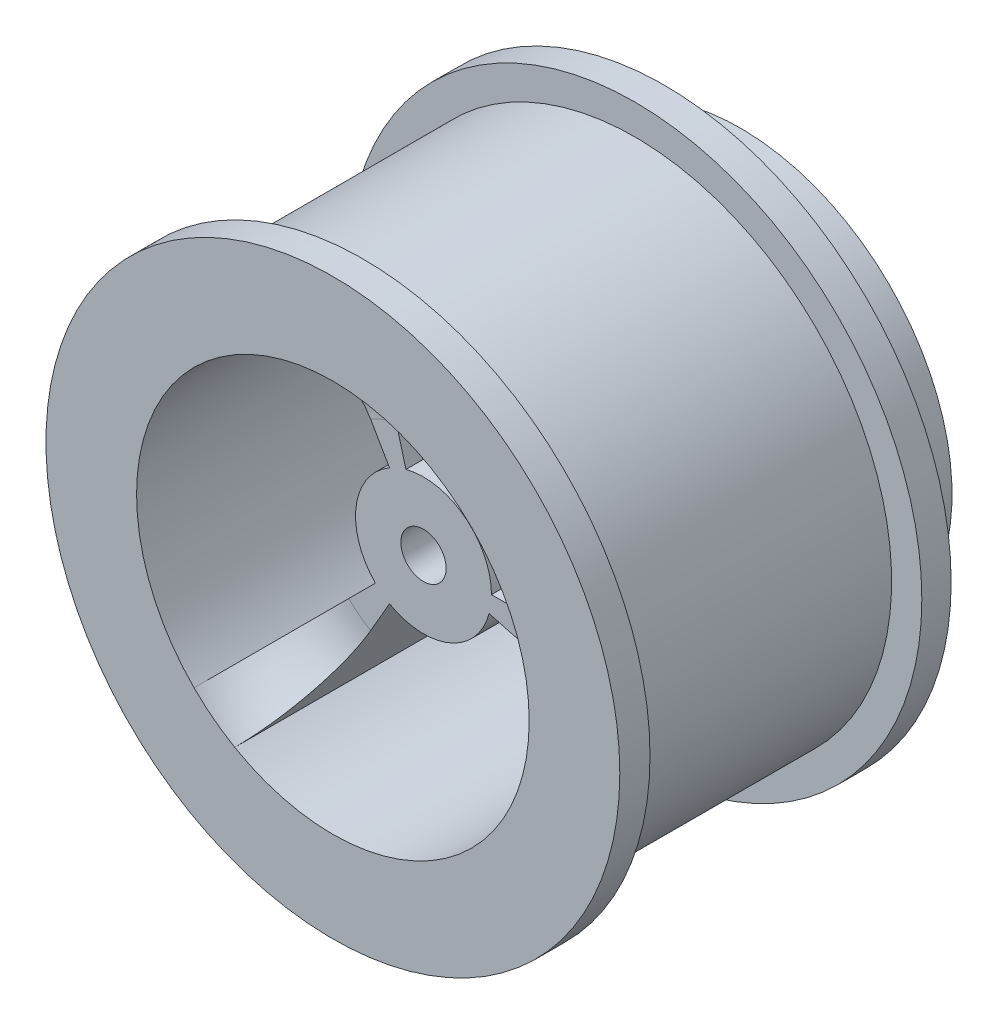
from build123d import *

# Parameters (mm, degrees)
SKETCH1_R             = 8.5
SKETCH1_R_2           = 6.5
BOSS_EXTRUDE1_DEPTH   = 9
SKETCH1_R_3           = 2.25
SKETCH1_R_4           = 0.75
BOSS_EXTRUDE1_2_DEPTH = 9
SKETCH2_R             = 9.5
BOSS_EXTRUDE2_DEPTH   = 1.5
SKETCH3_R             = 9.5
SKETCH3_R_2           = 6.5
BOSS_EXTRUDE3_DEPTH   = 1
BOSS_EXTRUDE4_REACH   = 19.051
CIRPATTERN1_COUNT     = 3
CUT_EXTRUDE2_START    = -2
SKETCH6_R             = 6.5
CUT_EXTRUDE2_DEPTH    = 2
FILLET1_R             = 3
BOSS_EXTRUDE5_START   = 1
SKETCH8_R             = 6.5
BOSS_EXTRUDE5_DEPTH   = 1
SKETCH7_R             = 1
CUT_EXTRUDE3_DEPTH    = 7
CIRPATTERN2_COUNT     = 3
FILLET2_R             = 1
SKETCH10_R            = 7
BOSS_EXTRUDE6_DEPTH   = 1
CUT_EXTRUDE5_START    = -14.5
SKETCH12_R            = 0.75
CUT_EXTRUDE5_DEPTH    = 14.5
SKETCH13_R            = 2.5
CUT_EXTRUDE6_DEPTH    = 2.5


with BuildPart() as part:
    # Sketch1 → Boss-Extrude1 (new body)
    with BuildSketch(Plane.XY):
        Circle(SKETCH1_R)
        Circle(SKETCH1_R_2, mode=Mode.SUBTRACT)
    extrude(amount=BOSS_EXTRUDE1_DEPTH)



with BuildPart() as body_2:
    # Sketch1 → Boss-Extrude1 2 (new body)
    with BuildSketch(Plane.XY):
        Circle(SKETCH1_R_3)
        Circle(SKETCH1_R_4, mode=Mode.SUBTRACT)
    extrude(amount=BOSS_EXTRUDE1_2_DEPTH)


with BuildPart() as part_1:
    add(part.part)

    add(body_2.part)  # Boss-Extrude2 merges body 2
    # Sketch2 → Boss-Extrude2 (add)
    with BuildSketch(Plane(origin=(0, 0, 0), x_dir=(-1, 0, 0), z_dir=(0, 0, -1))):
        Circle(SKETCH2_R)
    extrude(amount=BOSS_EXTRUDE2_DEPTH)

    # Sketch3 → Boss-Extrude3 (add)
    with BuildSketch(Plane.XY.offset(9)):
        Circle(SKETCH3_R)
        Circle(SKETCH3_R_2, mode=Mode.SUBTRACT)
    extrude(amount=BOSS_EXTRUDE3_DEPTH)

    # Sketch5 → Boss-Extrude4 (add, up to next)
    with BuildSketch(Plane.XY.offset(9), mode=Mode.PRIVATE) as boss_extrude4_sk1:
        with BuildLine():
            Line((2.25, 0), (6.5, 0))
            ThreePointArc((6.5, 0), (6.444391599, -0.848420249), (6.278517871, -1.682323793))
            Line((6.278517871, -1.682323793), (2.173333109, -0.582342851))
            ThreePointArc((2.173333109, -0.582342851), (2.230750938, -0.293683932), (2.25, 0))
        make_face()
    boss_extrude4_tool1 = extrude(boss_extrude4_sk1.sketch, amount=-BOSS_EXTRUDE4_REACH, mode=Mode.PRIVATE) - part_1.part
    boss_extrude4 = boss_extrude4_tool1.solids().sort_by_distance((4.665326, -0.614202, 9))[0]
    add(boss_extrude4)

    # CirPattern1: Boss-Extrude4 ×3 about axis
    cirpattern1_axis = Axis((0, 0, 0), (0, 0, 1))
    for i in range(1, CIRPATTERN1_COUNT):
        add(boss_extrude4.rotate(cirpattern1_axis, i * 360 / CIRPATTERN1_COUNT))

    # Sketch6 → Cut-Extrude2 (cut)
    with BuildSketch(Plane.XY.offset(9).offset(CUT_EXTRUDE2_START)):
        Circle(SKETCH6_R)
    extrude(amount=CUT_EXTRUDE2_DEPTH, mode=Mode.SUBTRACT)

    # Fillet1
    # the kernel refuses this fillet: 3 mm, written as the material it adds along each edge
    with BuildSketch(Plane(origin=(0, 0, 7), x_dir=(0.9659258262890711, -0.2588190451025104, 0), z_dir=(-0.2588190451025104, -0.9659258262890711, 0))) as fillet1_piece_1:
        with BuildLine():
            CenterArc((6.5 - FILLET1_R, FILLET1_R), FILLET1_R, 270, 90)
            Line((6.5 - FILLET1_R, 0), (6.5, 0))
            Line((6.5, 0), (6.5, FILLET1_R))
        make_face()
    revolve(axis=Axis((0, 0, 7), (0, 0, 1)), revolution_arc=15)
    with BuildSketch(Plane(origin=(0, 0, 7), x_dir=(-0.2588190451025142, 0.9659258262890701, 0), z_dir=(0.9659258262890701, 0.2588190451025142, 0))) as fillet1_piece_2:
        with BuildLine():
            CenterArc((6.5 - FILLET1_R, FILLET1_R), FILLET1_R, 270, 90)
            Line((6.5 - FILLET1_R, 0), (6.5, 0))
            Line((6.5, 0), (6.5, FILLET1_R))
        make_face()
    revolve(axis=Axis((0, 0, 7), (0, 0, 1)), revolution_arc=15)
    with BuildSketch(Plane(origin=(0, 0, 7), x_dir=(-0.7071067811865505, -0.7071067811865446, 0), z_dir=(-0.7071067811865446, 0.7071067811865505, 0))) as fillet1_piece_3:
        with BuildLine():
            CenterArc((6.5 - FILLET1_R, FILLET1_R), FILLET1_R, 270, 90)
            Line((6.5 - FILLET1_R, 0), (6.5, 0))
            Line((6.5, 0), (6.5, FILLET1_R))
        make_face()
    revolve(axis=Axis((0, 0, 7), (0, 0, 1)), revolution_arc=15)

    # Sketch8 → Boss-Extrude5 (add)
    with BuildSketch(Plane(origin=(0, 0, -1.5), x_dir=(-1, 0, 0), z_dir=(0, 0, -1)).offset(BOSS_EXTRUDE5_START)):
        Circle(SKETCH8_R)
    extrude(amount=-BOSS_EXTRUDE5_DEPTH)

    # Sketch7 → Cut-Extrude3 (cut)
    with BuildSketch(Plane.XY):
        with Locations((1.722075446, -4.157457896)):
            Circle(SKETCH7_R)
    cut_extrude3 = extrude(amount=-CUT_EXTRUDE3_DEPTH, mode=Mode.SUBTRACT)

    # CirPattern2: Cut-Extrude3 ×3 about axis
    cirpattern2_axis = Axis((0, 0, 0), (0, 0, 1))
    for i in range(1, CIRPATTERN2_COUNT):
        add(cut_extrude3.rotate(cirpattern2_axis, i * 360 / CIRPATTERN2_COUNT), mode=Mode.SUBTRACT)

    # Fillet2
    # the kernel refuses this fillet: 1 mm, written as the material it adds along each edge
    with BuildSketch(Plane(origin=(0, 0, 0), x_dir=(0.9268638778365579, -0.37539759184333915, 0), z_dir=(-0.37539759184333915, -0.9268638778365579, 0))) as fillet2_piece_1:
        with BuildLine():
            CenterArc((6.5 - FILLET2_R, FILLET2_R), FILLET2_R, 270, 90)
            Line((6.5 - FILLET2_R, 0), (6.5, 0))
            Line((6.5, 0), (6.5, FILLET2_R))
        make_face()
    revolve(axis=Axis((0, 0, 0), (0, 0, 1)), revolution_arc=149.097777135)
    with BuildSketch(Plane(origin=(-0.25, 0, 0), x_dir=(0, 0, 1), z_dir=(1, 0, 0))) as fillet2_piece_2_section:
        with BuildLine():
            CenterArc((FILLET2_R, -FILLET2_R), FILLET2_R, 90, 90)
            Line((0, -FILLET2_R), (0, 0))
            Line((0, 0), (FILLET2_R, 0))
        make_face()
    fillet2_piece_2 = extrude(amount=9.25, mode=Mode.PRIVATE)
    fillet2_piece_2 = fillet2_piece_2 - Plane(origin=(0, 0, 0.222961637), x_dir=(1, 0, 0), z_dir=(0, 0, -1)) * Cylinder(0.75, 23, mode=Mode.PRIVATE)
    fillet2_piece_2 = fillet2_piece_2 & Plane(origin=(0, 0, 0.222961637), x_dir=(1, 0, 0), z_dir=(0, 0, -1)) * Cylinder(8.5, 23, mode=Mode.PRIVATE)
    add(fillet2_piece_2)
    with BuildSketch(Plane(origin=(8.693332437, -2.329371406, 0), x_dir=(0, 0, 1), z_dir=(-0.9659258262890682, 0.25881904510252135, 0))) as fillet2_piece_3_section:
        with BuildLine():
            CenterArc((FILLET2_R, -FILLET2_R), FILLET2_R, 90, 90)
            Line((0, -FILLET2_R), (0, 0))
            Line((0, 0), (FILLET2_R, 0))
        make_face()
    fillet2_piece_3 = extrude(amount=9.25, mode=Mode.PRIVATE)
    fillet2_piece_3 = fillet2_piece_3 - Plane(origin=(0, 0, 0.222961624), x_dir=(1, 0, 0), z_dir=(0, 0, -1)) * Cylinder(0.75, 23, mode=Mode.PRIVATE)
    fillet2_piece_3 = fillet2_piece_3 & Plane(origin=(0, 0, 0.222961624), x_dir=(1, 0, 0), z_dir=(0, 0, -1)) * Cylinder(8.5, 23, mode=Mode.PRIVATE)
    add(fillet2_piece_3)
    with BuildSketch(Plane(origin=(0, 0, 0), x_dir=(-0.138328087862445, 0.9903864599782852, 0), z_dir=(0.9903864599782852, 0.138328087862445, 0))) as fillet2_piece_4:
        with BuildLine():
            CenterArc((6.5 - FILLET2_R, FILLET2_R), FILLET2_R, 270, 90)
            Line((6.5 - FILLET2_R, 0), (6.5, 0))
            Line((6.5, 0), (6.5, FILLET2_R))
        make_face()
    revolve(axis=Axis((0, 0, 0), (0, 0, 1)), revolution_arc=149.097777135)
    with BuildSketch(Plane(origin=(0, 0, 0), x_dir=(0.5547978045957125, 0.8319852138204006, 0), z_dir=(0.8319852138204006, -0.5547978045957125, 0))) as fillet2_piece_5:
        with BuildLine():
            CenterArc((2.25 + FILLET2_R, FILLET2_R), FILLET2_R, 180, 90)
            Line((2.25 + FILLET2_R, 0), (2.25, 0))
            Line((2.25, 0), (2.25, FILLET2_R))
        make_face()
    revolve(axis=Axis((0, 0, 0), (0, 0, 1)), revolution_arc=232.393578389)
    with BuildSketch(Plane(origin=(0.125, -0.216506351, 0), x_dir=(0, 0, 1), z_dir=(-0.49999999999999983, 0.8660254037844388, 0))) as fillet2_piece_6_section:
        with BuildLine():
            CenterArc((FILLET2_R, -FILLET2_R), FILLET2_R, 90, 90)
            Line((0, -FILLET2_R), (0, 0))
            Line((0, 0), (FILLET2_R, 0))
        make_face()
    fillet2_piece_6 = extrude(amount=9.25, mode=Mode.PRIVATE)
    fillet2_piece_6 = fillet2_piece_6 - Plane(origin=(0, 0, 0.222961635), x_dir=(1, 0, 0), z_dir=(0, 0, -1)) * Cylinder(0.75, 23, mode=Mode.PRIVATE)
    fillet2_piece_6 = fillet2_piece_6 & Plane(origin=(0, 0, 0.222961635), x_dir=(1, 0, 0), z_dir=(0, 0, -1)) * Cylinder(8.5, 23, mode=Mode.PRIVATE)
    add(fillet2_piece_6)
    with BuildSketch(Plane(origin=(-2.329371406, 8.693332437, 0), x_dir=(0, 0, 1), z_dir=(0.25881904510251996, -0.9659258262890685, 0))) as fillet2_piece_7_section:
        with BuildLine():
            CenterArc((FILLET2_R, -FILLET2_R), FILLET2_R, 90, 90)
            Line((0, -FILLET2_R), (0, 0))
            Line((0, 0), (FILLET2_R, 0))
        make_face()
    fillet2_piece_7 = extrude(amount=9.25, mode=Mode.PRIVATE)
    fillet2_piece_7 = fillet2_piece_7 - Plane(origin=(0, 0, 0.222961632), x_dir=(1, 0, 0), z_dir=(0, 0, -1)) * Cylinder(0.75, 23, mode=Mode.PRIVATE)
    fillet2_piece_7 = fillet2_piece_7 & Plane(origin=(0, 0, 0.222961632), x_dir=(1, 0, 0), z_dir=(0, 0, -1)) * Cylinder(8.5, 23, mode=Mode.PRIVATE)
    add(fillet2_piece_7)
    with BuildSketch(Plane(origin=(0, 0, 0), x_dir=(-0.7885357899741134, -0.614988868134945, 0), z_dir=(-0.614988868134945, 0.7885357899741134, 0))) as fillet2_piece_8:
        with BuildLine():
            CenterArc((6.5 - FILLET2_R, FILLET2_R), FILLET2_R, 270, 90)
            Line((6.5 - FILLET2_R, 0), (6.5, 0))
            Line((6.5, 0), (6.5, FILLET2_R))
        make_face()
    revolve(axis=Axis((0, 0, 0), (0, 0, 1)), revolution_arc=149.097777135)
    with BuildSketch(Plane(origin=(0, 0, 0), x_dir=(-0.9979192330393512, 0.06447638583352278, 0), z_dir=(0.06447638583352278, 0.9979192330393512, 0))) as fillet2_piece_9:
        with BuildLine():
            CenterArc((2.25 + FILLET2_R, FILLET2_R), FILLET2_R, 180, 90)
            Line((2.25 + FILLET2_R, 0), (2.25, 0))
            Line((2.25, 0), (2.25, FILLET2_R))
        make_face()
    revolve(axis=Axis((0, 0, 0), (0, 0, 1)), revolution_arc=232.393578389)
    with BuildSketch(Plane(origin=(0.125, 0.216506351, 0), x_dir=(0, 0, 1), z_dir=(-0.5000000000000004, -0.8660254037844384, 0))) as fillet2_piece_10_section:
        with BuildLine():
            CenterArc((FILLET2_R, -FILLET2_R), FILLET2_R, 90, 90)
            Line((0, -FILLET2_R), (0, 0))
            Line((0, 0), (FILLET2_R, 0))
        make_face()
    fillet2_piece_10 = extrude(amount=9.25, mode=Mode.PRIVATE)
    fillet2_piece_10 = fillet2_piece_10 - Plane(origin=(0, 0, 0.222961664), x_dir=(1, 0, 0), z_dir=(0, 0, -1)) * Cylinder(0.75, 23, mode=Mode.PRIVATE)
    fillet2_piece_10 = fillet2_piece_10 & Plane(origin=(0, 0, 0.222961664), x_dir=(1, 0, 0), z_dir=(0, 0, -1)) * Cylinder(8.5, 23, mode=Mode.PRIVATE)
    add(fillet2_piece_10)
    with BuildSketch(Plane(origin=(-6.363961031, -6.363961031, 0), x_dir=(0, 0, 1), z_dir=(0.7071067811865483, 0.7071067811865468, 0))) as fillet2_piece_11_section:
        with BuildLine():
            CenterArc((FILLET2_R, -FILLET2_R), FILLET2_R, 90, 90)
            Line((0, -FILLET2_R), (0, 0))
            Line((0, 0), (FILLET2_R, 0))
        make_face()
    fillet2_piece_11 = extrude(amount=9.25, mode=Mode.PRIVATE)
    fillet2_piece_11 = fillet2_piece_11 - Plane(origin=(0, 0, 0.22296162), x_dir=(1, 0, 0), z_dir=(0, 0, -1)) * Cylinder(0.75, 23, mode=Mode.PRIVATE)
    fillet2_piece_11 = fillet2_piece_11 & Plane(origin=(0, 0, 0.22296162), x_dir=(1, 0, 0), z_dir=(0, 0, -1)) * Cylinder(8.5, 23, mode=Mode.PRIVATE)
    add(fillet2_piece_11)
    with BuildSketch(Plane(origin=(0, 0, 0), x_dir=(0.44312142844363894, -0.8964615996539222, 0), z_dir=(-0.8964615996539222, -0.44312142844363894, 0))) as fillet2_piece_12:
        with BuildLine():
            CenterArc((2.25 + FILLET2_R, FILLET2_R), FILLET2_R, 180, 90)
            Line((2.25 + FILLET2_R, 0), (2.25, 0))
            Line((2.25, 0), (2.25, FILLET2_R))
        make_face()
    revolve(axis=Axis((0, 0, 0), (0, 0, 1)), revolution_arc=232.393578389)

    # Sketch10 → Boss-Extrude6 (add)
    with BuildSketch(Plane(origin=(0, 0, -2.5), x_dir=(-1, 0, 0), z_dir=(0, 0, -1))):
        Circle(SKETCH10_R)
    extrude(amount=BOSS_EXTRUDE6_DEPTH)

    # Sketch11 → Cut-Revolve1 (revolve, cut)
    with BuildSketch(Plane(origin=(0, 0, 0), x_dir=(1, 0, 0), z_dir=(0, 1, 0)), mode=Mode.PRIVATE) as cut_revolve1_sk:
        Polygon((-6.5, 2.5), (-10.5, 3.205307923), (-10.5, 0.794692077), (-6.5, 1.5), align=None)
    revolve(cut_revolve1_sk.sketch.rotate(Axis((0, 0, 0), (0, 0, -1)), 180), axis=Axis((0, 0, 0), (0, 0, -1)), mode=Mode.SUBTRACT)

    # Sketch12 → Cut-Extrude5 (cut)
    with BuildSketch(Plane.XY.offset(7).offset(CUT_EXTRUDE5_START)):
        with Locations(Location((0, 0, 0), (0, 0, 180))):
            Circle(SKETCH12_R)
    extrude(amount=CUT_EXTRUDE5_DEPTH, mode=Mode.SUBTRACT)

    # Sketch13 → Cut-Extrude6 (cut)
    with BuildSketch(Plane(origin=(0, 0, -3.5), x_dir=(-1, 0, 0), z_dir=(0, 0, -1))):
        Circle(SKETCH13_R)
    extrude(amount=-CUT_EXTRUDE6_DEPTH, mode=Mode.SUBTRACT)


solid = part_1.part
